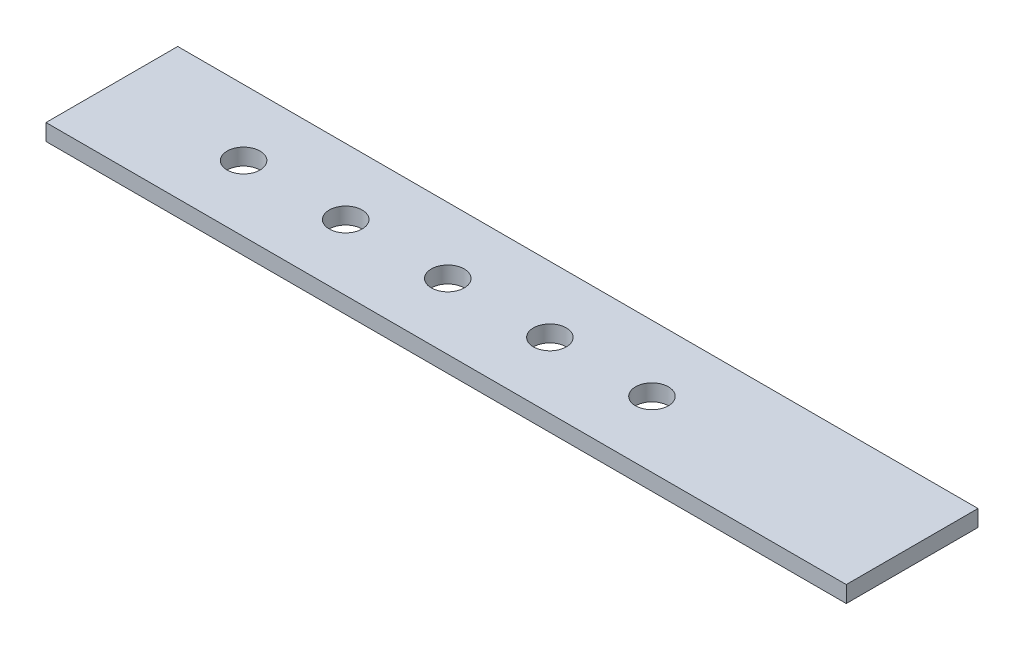
from build123d import *

# Parameters (mm, degrees)
SKETCH1_W           = 154.305
SKETCH1_H           = 25.4
SKETCH1_R           = 3.175
BOSS_EXTRUDE1_DEPTH = 3.175


with BuildPart() as part:
    # Sketch1 → Boss-Extrude1 (new body)
    with BuildSketch(Plane(origin=(0, 0, 0), x_dir=(1, 0, 0), z_dir=(0, 1, 0))):
        with Locations((-77.1525, 0)):
            Rectangle(SKETCH1_W, SKETCH1_H)
        with Locations((-109.22, 0)):
            Circle(SKETCH1_R, mode=Mode.SUBTRACT)
        with Locations((-89.535, 0)):
            Circle(SKETCH1_R, mode=Mode.SUBTRACT)
        with Locations((-69.85, 0)):
            Circle(SKETCH1_R, mode=Mode.SUBTRACT)
        with Locations((-128.905, 0)):
            Circle(SKETCH1_R, mode=Mode.SUBTRACT)
        with Locations((-50.165, 0)):
            Circle(SKETCH1_R, mode=Mode.SUBTRACT)
    extrude(amount=BOSS_EXTRUDE1_DEPTH)


solid = part.part
